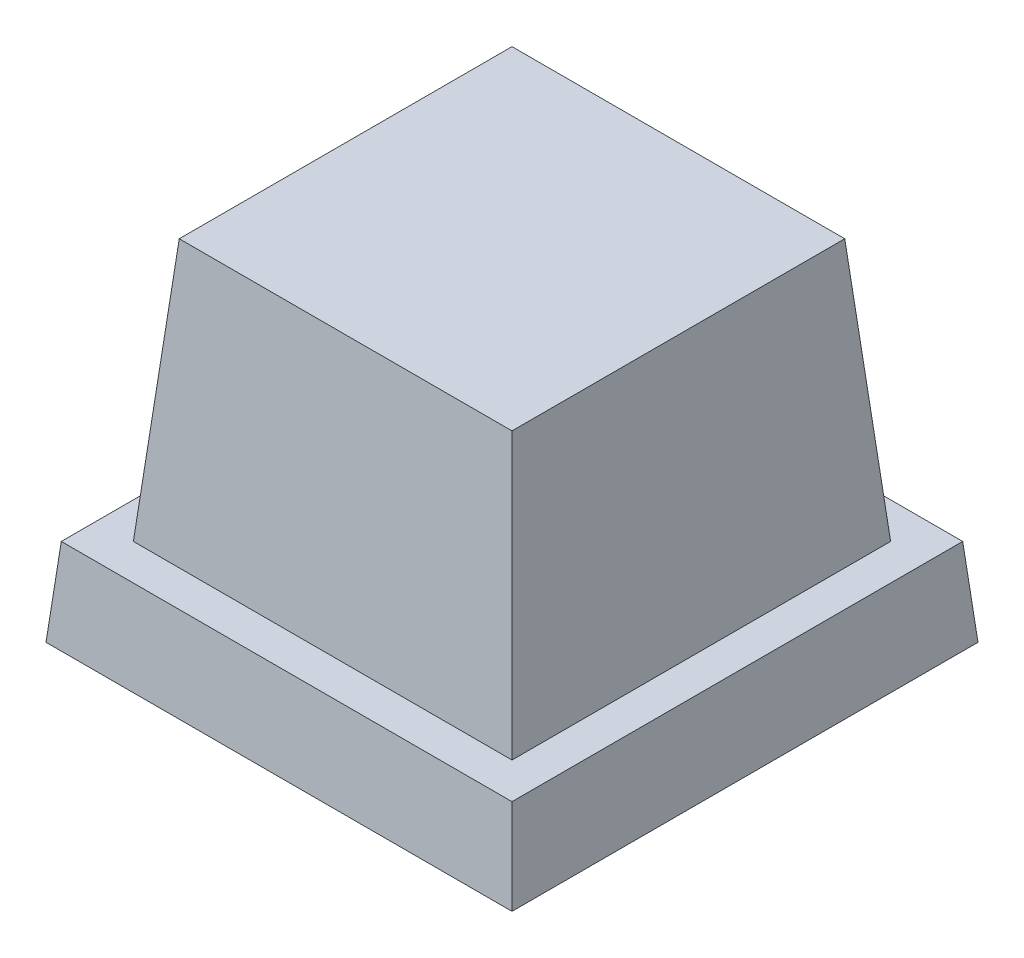
from build123d import *

# Parameters (mm, degrees)
SKETCH1_W           = 32
SKETCH1_H           = 32
BOSS_EXTRUDE1_DEPTH = 6
BOSS_EXTRUDE1_TAPER = 5
SKETCH2_W           = 26
SKETCH2_H           = 26
BOSS_EXTRUDE2_DEPTH = 18
BOSS_EXTRUDE2_TAPER = 5
SHELL1_T            = -0.8
CHAMFER1_SIZE       = 2.5
CHAMFER1_SIZE_2     = 2.750157169


with BuildPart() as part:
    # Sketch1 → Boss-Extrude1 (new body)
    with BuildSketch(Plane(origin=(0, 0, 0), x_dir=(1, 0, 0), z_dir=(0, 1, 0))):
        with Locations((-16, 16)):
            Rectangle(SKETCH1_W, SKETCH1_H)
    extrude(amount=BOSS_EXTRUDE1_DEPTH, taper=BOSS_EXTRUDE1_TAPER)

    # Sketch2 → Boss-Extrude2 (add)
    with BuildSketch(Plane(origin=(0, 6, 0), x_dir=(1, 0, 0), z_dir=(0, 1, 0))):
        with Locations((-16, 16)):
            Rectangle(SKETCH2_W, SKETCH2_H)
    extrude(amount=BOSS_EXTRUDE2_DEPTH, taper=BOSS_EXTRUDE2_TAPER)

    # Shell1
    shell1_openings = [part.faces().sort_by_distance(p)[0] for p in [
        (-16, 0, -16),
    ]]
    offset(amount=SHELL1_T, openings=shell1_openings, kind=Kind.INTERSECTION)

    # Chamfer1
    # the kernel refuses this chamfer: 2.750157169, 2.5 mm, written as the material it adds along each edge
    with BuildSketch(Plane(origin=(5.830274952, 5.2, -1.25799692), x_dir=(0, 0.030161850139926293, -0.9995450278982617), z_dir=(-1, 0, 0))) as chamfer1_piece_1_section:
        Polygon((CHAMFER1_SIZE * 0.999545027898, CHAMFER1_SIZE * 0.0301618501399), (-CHAMFER1_SIZE_2 * 0.117163164513, CHAMFER1_SIZE_2 * 0.993112678869), (0, 0), align=None)
    chamfer1_piece_1 = extrude(amount=43.660549905, mode=Mode.PRIVATE)
    chamfer1_piece_1 = split(chamfer1_piece_1, bisect_by=Plane(origin=(-1.2737044, 5.379537315, -3.779154262), z_dir=(-0.9961946980917455, -0.08715574274765792, 0)), keep=Keep.TOP, mode=Mode.PRIVATE)
    chamfer1_piece_1 = split(chamfer1_piece_1, bisect_by=Plane(origin=(-3.729971497, 5.164641789, -3.779154262), z_dir=(0.9961946980917455, 0.08715574274765821, 0)), keep=Keep.TOP, mode=Mode.PRIVATE)
    chamfer1_piece_1 = split(chamfer1_piece_1, bisect_by=Plane(origin=(-2.501837948, 5.275543614, -3.739674149), z_dir=(0, -0.08715574274765829, -0.9961946980917455)), keep=Keep.TOP, mode=Mode.PRIVATE)
    add(chamfer1_piece_1)
    with BuildSketch(Plane(origin=(5.830274952, 5.2, -1.25799692), x_dir=(0, 0.030161850139926293, -0.9995450278982617), z_dir=(-1, 0, 0))) as chamfer1_piece_2_section:
        Polygon((CHAMFER1_SIZE * 0.999545027898, CHAMFER1_SIZE * 0.0301618501399), (-CHAMFER1_SIZE_2 * 0.117163164513, CHAMFER1_SIZE_2 * 0.993112678869), (0, 0), align=None)
    chamfer1_piece_2 = extrude(amount=43.660549905, mode=Mode.PRIVATE)
    chamfer1_piece_2 = split(chamfer1_piece_2, bisect_by=Plane(origin=(-1.187972058, 4.399612159, -1.99521412), z_dir=(-0.9961946980917455, -0.08715574274765792, 0)), keep=Keep.TOP, mode=Mode.PRIVATE)
    chamfer1_piece_2 = split(chamfer1_piece_2, bisect_by=Plane(origin=(-3.644239154, 4.184716633, -1.99521412), z_dir=(0.9961946980917455, 0.08715574274765821, 0)), keep=Keep.TOP, mode=Mode.PRIVATE)
    chamfer1_piece_2 = split(chamfer1_piece_2, bisect_by=Plane(origin=(-2.416105606, 4.148173113, -3.641042011), z_dir=(0, 0.08715574274765829, 0.9961946980917455)), keep=Keep.TOP, mode=Mode.PRIVATE)
    add(chamfer1_piece_2)
    with BuildSketch(Plane(origin=(5.830274952, 5.2, -1.25799692), x_dir=(0, 0.030161850139926293, -0.9995450278982617), z_dir=(-1, 0, 0))) as chamfer1_piece_3_section:
        Polygon((CHAMFER1_SIZE * 0.999545027898, CHAMFER1_SIZE * 0.0301618501399), (-CHAMFER1_SIZE_2 * 0.117163164513, CHAMFER1_SIZE_2 * 0.993112678869), (0, 0), align=None)
    chamfer1_piece_3 = extrude(amount=43.660549905, mode=Mode.PRIVATE)
    chamfer1_piece_3 = split(chamfer1_piece_3, bisect_by=Plane(origin=(-3.747130429, 5.360769289, -1.993289961), z_dir=(-0.9961946980917455, -0.08715574274765821, 0)), keep=Keep.TOP, mode=Mode.PRIVATE)
    chamfer1_piece_3 = split(chamfer1_piece_3, bisect_by=Plane(origin=(-16, 4.144649452, -3.64073373), z_dir=(0, 0.08715574274765829, 0.9961946980917455)), keep=Keep.TOP, mode=Mode.PRIVATE)
    chamfer1_piece_3 = split(chamfer1_piece_3, bisect_by=Plane(origin=(-28.252869571, 5.360769289, -1.993289961), z_dir=(0.9961946980917455, -0.08715574274765829, 0)), keep=Keep.TOP, mode=Mode.PRIVATE)
    add(chamfer1_piece_3)
    with BuildSketch(Plane(origin=(5.830274952, 5.2, -1.25799692), x_dir=(0, 0.030161850139926293, -0.9995450278982617), z_dir=(-1, 0, 0))) as chamfer1_piece_4_section:
        Polygon((CHAMFER1_SIZE * 0.999545027898, CHAMFER1_SIZE * 0.0301618501399), (-CHAMFER1_SIZE_2 * 0.117163164513, CHAMFER1_SIZE_2 * 0.993112678869), (0, 0), align=None)
    chamfer1_piece_4 = extrude(amount=43.660549905, mode=Mode.PRIVATE)
    chamfer1_piece_4 = split(chamfer1_piece_4, bisect_by=Plane(origin=(-29.498162052, 5.275543614, -3.739674149), z_dir=(0, -0.08715574274765829, -0.9961946980917455)), keep=Keep.TOP, mode=Mode.PRIVATE)
    chamfer1_piece_4 = split(chamfer1_piece_4, bisect_by=Plane(origin=(-28.270028503, 5.164641789, -3.779154262), z_dir=(-0.9961946980917455, 0.08715574274765829, 0)), keep=Keep.TOP, mode=Mode.PRIVATE)
    chamfer1_piece_4 = split(chamfer1_piece_4, bisect_by=Plane(origin=(-30.7262956, 5.379537315, -3.779154262), z_dir=(0.9961946980917455, -0.08715574274765851, 0)), keep=Keep.TOP, mode=Mode.PRIVATE)
    add(chamfer1_piece_4)
    with BuildSketch(Plane(origin=(5.830274952, 5.2, -1.25799692), x_dir=(0, 0.030161850139926293, -0.9995450278982617), z_dir=(-1, 0, 0))) as chamfer1_piece_5_section:
        Polygon((CHAMFER1_SIZE * 0.999545027898, CHAMFER1_SIZE * 0.0301618501399), (-CHAMFER1_SIZE_2 * 0.117163164513, CHAMFER1_SIZE_2 * 0.993112678869), (0, 0), align=None)
    chamfer1_piece_5 = extrude(amount=43.660549905, mode=Mode.PRIVATE)
    chamfer1_piece_5 = split(chamfer1_piece_5, bisect_by=Plane(origin=(-29.583894394, 4.148173113, -3.641042011), z_dir=(0, 0.08715574274765829, 0.9961946980917455)), keep=Keep.TOP, mode=Mode.PRIVATE)
    chamfer1_piece_5 = split(chamfer1_piece_5, bisect_by=Plane(origin=(-28.355760846, 4.184716633, -1.99521412), z_dir=(-0.9961946980917455, 0.08715574274765829, 0)), keep=Keep.TOP, mode=Mode.PRIVATE)
    chamfer1_piece_5 = split(chamfer1_piece_5, bisect_by=Plane(origin=(-30.812027942, 4.399612159, -1.99521412), z_dir=(0.9961946980917455, -0.08715574274765851, 0)), keep=Keep.TOP, mode=Mode.PRIVATE)
    add(chamfer1_piece_5)
    with BuildSketch(Plane(origin=(-30.74200308, 5.2, 5.830274952), x_dir=(0.9995450278982617, 0.030161850139926356, 0), z_dir=(0, 0, -1))) as chamfer1_piece_6_section:
        Polygon((CHAMFER1_SIZE * 0.999545027898, CHAMFER1_SIZE * 0.0301618501399), (-CHAMFER1_SIZE_2 * 0.117163164513, CHAMFER1_SIZE_2 * 0.993112678869), (0, 0), align=None)
    chamfer1_piece_6 = extrude(amount=43.660549905, mode=Mode.PRIVATE)
    chamfer1_piece_6 = split(chamfer1_piece_6, bisect_by=Plane(origin=(-28.220845738, 5.164641789, -3.729971497), z_dir=(0, 0.08715574274765829, 0.9961946980917455)), keep=Keep.TOP, mode=Mode.PRIVATE)
    chamfer1_piece_6 = split(chamfer1_piece_6, bisect_by=Plane(origin=(-28.260325851, 5.275543614, -2.501837948), z_dir=(0.9961946980917455, -0.08715574274765829, 0)), keep=Keep.TOP, mode=Mode.PRIVATE)
    chamfer1_piece_6 = split(chamfer1_piece_6, bisect_by=Plane(origin=(-28.220845738, 5.379537315, -1.2737044), z_dir=(0, -0.08715574274765792, -0.9961946980917455)), keep=Keep.TOP, mode=Mode.PRIVATE)
    add(chamfer1_piece_6)
    with BuildSketch(Plane(origin=(-30.74200308, 5.2, 5.830274952), x_dir=(0.9995450278982617, 0.030161850139926356, 0), z_dir=(0, 0, -1))) as chamfer1_piece_7_section:
        Polygon((CHAMFER1_SIZE * 0.999545027898, CHAMFER1_SIZE * 0.0301618501399), (-CHAMFER1_SIZE_2 * 0.117163164513, CHAMFER1_SIZE_2 * 0.993112678869), (0, 0), align=None)
    chamfer1_piece_7 = extrude(amount=43.660549905, mode=Mode.PRIVATE)
    chamfer1_piece_7 = split(chamfer1_piece_7, bisect_by=Plane(origin=(-30.00478588, 4.184716633, -3.644239154), z_dir=(0, 0.08715574274765829, 0.9961946980917455)), keep=Keep.TOP, mode=Mode.PRIVATE)
    chamfer1_piece_7 = split(chamfer1_piece_7, bisect_by=Plane(origin=(-28.358957989, 4.148173113, -2.416105606), z_dir=(-0.9961946980917455, 0.08715574274765829, 0)), keep=Keep.TOP, mode=Mode.PRIVATE)
    chamfer1_piece_7 = split(chamfer1_piece_7, bisect_by=Plane(origin=(-30.00478588, 4.399612159, -1.187972058), z_dir=(0, -0.08715574274765792, -0.9961946980917455)), keep=Keep.TOP, mode=Mode.PRIVATE)
    add(chamfer1_piece_7)
    with BuildSketch(Plane(origin=(-30.74200308, 5.2, 5.830274952), x_dir=(0.9995450278982617, 0.030161850139926356, 0), z_dir=(0, 0, -1))) as chamfer1_piece_8_section:
        Polygon((CHAMFER1_SIZE * 0.999545027898, CHAMFER1_SIZE * 0.0301618501399), (-CHAMFER1_SIZE_2 * 0.117163164513, CHAMFER1_SIZE_2 * 0.993112678869), (0, 0), align=None)
    chamfer1_piece_8 = extrude(amount=43.660549905, mode=Mode.PRIVATE)
    chamfer1_piece_8 = split(chamfer1_piece_8, bisect_by=Plane(origin=(-30.006710039, 5.360769289, -28.252869571), z_dir=(0, -0.08715574274765829, 0.9961946980917455)), keep=Keep.TOP, mode=Mode.PRIVATE)
    chamfer1_piece_8 = split(chamfer1_piece_8, bisect_by=Plane(origin=(-30.006710039, 5.360769289, -3.747130429), z_dir=(0, -0.08715574274765829, -0.9961946980917455)), keep=Keep.TOP, mode=Mode.PRIVATE)
    chamfer1_piece_8 = split(chamfer1_piece_8, bisect_by=Plane(origin=(-28.35926627, 4.144649452, -16), z_dir=(-0.9961946980917455, 0.08715574274765829, 0)), keep=Keep.TOP, mode=Mode.PRIVATE)
    add(chamfer1_piece_8)
    with BuildSketch(Plane(origin=(-30.74200308, 5.2, 5.830274952), x_dir=(0.9995450278982617, 0.030161850139926356, 0), z_dir=(0, 0, -1))) as chamfer1_piece_9_section:
        Polygon((CHAMFER1_SIZE * 0.999545027898, CHAMFER1_SIZE * 0.0301618501399), (-CHAMFER1_SIZE_2 * 0.117163164513, CHAMFER1_SIZE_2 * 0.993112678869), (0, 0), align=None)
    chamfer1_piece_9 = extrude(amount=43.660549905, mode=Mode.PRIVATE)
    chamfer1_piece_9 = split(chamfer1_piece_9, bisect_by=Plane(origin=(-28.220845738, 5.379537315, -30.7262956), z_dir=(0, -0.08715574274765836, 0.9961946980917455)), keep=Keep.TOP, mode=Mode.PRIVATE)
    chamfer1_piece_9 = split(chamfer1_piece_9, bisect_by=Plane(origin=(-28.220845738, 5.164641789, -28.270028503), z_dir=(0, 0.08715574274765829, -0.9961946980917455)), keep=Keep.TOP, mode=Mode.PRIVATE)
    chamfer1_piece_9 = split(chamfer1_piece_9, bisect_by=Plane(origin=(-28.260325851, 5.275543614, -29.498162052), z_dir=(0.9961946980917455, -0.08715574274765829, 0)), keep=Keep.TOP, mode=Mode.PRIVATE)
    add(chamfer1_piece_9)
    with BuildSketch(Plane(origin=(-30.74200308, 5.2, 5.830274952), x_dir=(0.9995450278982617, 0.030161850139926356, 0), z_dir=(0, 0, -1))) as chamfer1_piece_10_section:
        Polygon((CHAMFER1_SIZE * 0.999545027898, CHAMFER1_SIZE * 0.0301618501399), (-CHAMFER1_SIZE_2 * 0.117163164513, CHAMFER1_SIZE_2 * 0.993112678869), (0, 0), align=None)
    chamfer1_piece_10 = extrude(amount=43.660549905, mode=Mode.PRIVATE)
    chamfer1_piece_10 = split(chamfer1_piece_10, bisect_by=Plane(origin=(-30.00478588, 4.399612159, -30.812027942), z_dir=(0, -0.08715574274765836, 0.9961946980917455)), keep=Keep.TOP, mode=Mode.PRIVATE)
    chamfer1_piece_10 = split(chamfer1_piece_10, bisect_by=Plane(origin=(-30.00478588, 4.184716633, -28.355760846), z_dir=(0, 0.08715574274765829, -0.9961946980917455)), keep=Keep.TOP, mode=Mode.PRIVATE)
    chamfer1_piece_10 = split(chamfer1_piece_10, bisect_by=Plane(origin=(-28.358957989, 4.148173113, -29.583894394), z_dir=(-0.9961946980917455, 0.08715574274765829, 0)), keep=Keep.TOP, mode=Mode.PRIVATE)
    add(chamfer1_piece_10)
    with BuildSketch(Plane(origin=(5.830274952, 5.2, -30.74200308), x_dir=(0, -0.9937112432628153, -0.11197305485280758), z_dir=(-1, 0, 0))) as chamfer1_piece_11_section:
        Polygon((CHAMFER1_SIZE_2 * 0.99968896676, CHAMFER1_SIZE_2 * 0.0249393220908), (-CHAMFER1_SIZE * 0.111973054853, CHAMFER1_SIZE * 0.993711243263), (0, 0), align=None)
    chamfer1_piece_11 = extrude(amount=43.660549905, mode=Mode.PRIVATE)
    chamfer1_piece_11 = split(chamfer1_piece_11, bisect_by=Plane(origin=(-1.187972058, 4.399612159, -30.00478588), z_dir=(-0.9961946980917455, -0.08715574274765792, 0)), keep=Keep.TOP, mode=Mode.PRIVATE)
    chamfer1_piece_11 = split(chamfer1_piece_11, bisect_by=Plane(origin=(-2.416105606, 4.148173113, -28.358957989), z_dir=(0, 0.08715574274765829, -0.9961946980917455)), keep=Keep.TOP, mode=Mode.PRIVATE)
    chamfer1_piece_11 = split(chamfer1_piece_11, bisect_by=Plane(origin=(-3.644239154, 4.184716633, -30.00478588), z_dir=(0.9961946980917455, 0.08715574274765821, 0)), keep=Keep.TOP, mode=Mode.PRIVATE)
    add(chamfer1_piece_11)
    with BuildSketch(Plane(origin=(5.830274952, 5.2, -30.74200308), x_dir=(0, -0.9937112432628153, -0.11197305485280758), z_dir=(-1, 0, 0))) as chamfer1_piece_12_section:
        Polygon((CHAMFER1_SIZE_2 * 0.99968896676, CHAMFER1_SIZE_2 * 0.0249393220908), (-CHAMFER1_SIZE * 0.111973054853, CHAMFER1_SIZE * 0.993711243263), (0, 0), align=None)
    chamfer1_piece_12 = extrude(amount=43.660549905, mode=Mode.PRIVATE)
    chamfer1_piece_12 = split(chamfer1_piece_12, bisect_by=Plane(origin=(-1.2737044, 5.379537315, -28.220845738), z_dir=(-0.9961946980917455, -0.08715574274765792, 0)), keep=Keep.TOP, mode=Mode.PRIVATE)
    chamfer1_piece_12 = split(chamfer1_piece_12, bisect_by=Plane(origin=(-2.501837948, 5.275543614, -28.260325851), z_dir=(0, -0.08715574274765829, 0.9961946980917455)), keep=Keep.TOP, mode=Mode.PRIVATE)
    chamfer1_piece_12 = split(chamfer1_piece_12, bisect_by=Plane(origin=(-3.729971497, 5.164641789, -28.220845738), z_dir=(0.9961946980917455, 0.08715574274765821, 0)), keep=Keep.TOP, mode=Mode.PRIVATE)
    add(chamfer1_piece_12)
    with BuildSketch(Plane(origin=(5.830274952, 5.2, -30.74200308), x_dir=(0, -0.9937112432628153, -0.11197305485280758), z_dir=(-1, 0, 0))) as chamfer1_piece_13_section:
        Polygon((CHAMFER1_SIZE_2 * 0.99968896676, CHAMFER1_SIZE_2 * 0.0249393220908), (-CHAMFER1_SIZE * 0.111973054853, CHAMFER1_SIZE * 0.993711243263), (0, 0), align=None)
    chamfer1_piece_13 = extrude(amount=43.660549905, mode=Mode.PRIVATE)
    chamfer1_piece_13 = split(chamfer1_piece_13, bisect_by=Plane(origin=(-16, 4.144649452, -28.35926627), z_dir=(0, 0.08715574274765829, -0.9961946980917455)), keep=Keep.TOP, mode=Mode.PRIVATE)
    chamfer1_piece_13 = split(chamfer1_piece_13, bisect_by=Plane(origin=(-3.747130429, 5.360769289, -30.006710039), z_dir=(-0.9961946980917455, -0.08715574274765821, 0)), keep=Keep.TOP, mode=Mode.PRIVATE)
    chamfer1_piece_13 = split(chamfer1_piece_13, bisect_by=Plane(origin=(-28.252869571, 5.360769289, -30.006710039), z_dir=(0.9961946980917455, -0.08715574274765829, 0)), keep=Keep.TOP, mode=Mode.PRIVATE)
    add(chamfer1_piece_13)
    with BuildSketch(Plane(origin=(5.830274952, 5.2, -30.74200308), x_dir=(0, -0.9937112432628153, -0.11197305485280758), z_dir=(-1, 0, 0))) as chamfer1_piece_14_section:
        Polygon((CHAMFER1_SIZE_2 * 0.99968896676, CHAMFER1_SIZE_2 * 0.0249393220908), (-CHAMFER1_SIZE * 0.111973054853, CHAMFER1_SIZE * 0.993711243263), (0, 0), align=None)
    chamfer1_piece_14 = extrude(amount=43.660549905, mode=Mode.PRIVATE)
    chamfer1_piece_14 = split(chamfer1_piece_14, bisect_by=Plane(origin=(-30.812027942, 4.399612159, -30.00478588), z_dir=(0.9961946980917455, -0.08715574274765851, 0)), keep=Keep.TOP, mode=Mode.PRIVATE)
    chamfer1_piece_14 = split(chamfer1_piece_14, bisect_by=Plane(origin=(-29.583894394, 4.148173113, -28.358957989), z_dir=(0, 0.08715574274765829, -0.9961946980917455)), keep=Keep.TOP, mode=Mode.PRIVATE)
    chamfer1_piece_14 = split(chamfer1_piece_14, bisect_by=Plane(origin=(-28.355760846, 4.184716633, -30.00478588), z_dir=(-0.9961946980917455, 0.08715574274765829, 0)), keep=Keep.TOP, mode=Mode.PRIVATE)
    add(chamfer1_piece_14)
    with BuildSketch(Plane(origin=(5.830274952, 5.2, -30.74200308), x_dir=(0, -0.9937112432628153, -0.11197305485280758), z_dir=(-1, 0, 0))) as chamfer1_piece_15_section:
        Polygon((CHAMFER1_SIZE_2 * 0.99968896676, CHAMFER1_SIZE_2 * 0.0249393220908), (-CHAMFER1_SIZE * 0.111973054853, CHAMFER1_SIZE * 0.993711243263), (0, 0), align=None)
    chamfer1_piece_15 = extrude(amount=43.660549905, mode=Mode.PRIVATE)
    chamfer1_piece_15 = split(chamfer1_piece_15, bisect_by=Plane(origin=(-30.7262956, 5.379537315, -28.220845738), z_dir=(0.9961946980917455, -0.08715574274765851, 0)), keep=Keep.TOP, mode=Mode.PRIVATE)
    chamfer1_piece_15 = split(chamfer1_piece_15, bisect_by=Plane(origin=(-29.498162052, 5.275543614, -28.260325851), z_dir=(0, -0.08715574274765829, 0.9961946980917455)), keep=Keep.TOP, mode=Mode.PRIVATE)
    chamfer1_piece_15 = split(chamfer1_piece_15, bisect_by=Plane(origin=(-28.270028503, 5.164641789, -28.220845738), z_dir=(-0.9961946980917455, 0.08715574274765829, 0)), keep=Keep.TOP, mode=Mode.PRIVATE)
    add(chamfer1_piece_15)
    with BuildSketch(Plane(origin=(-1.25799692, 5.2, 5.830274952), x_dir=(0.11197305485280797, -0.9937112432628151, 0), z_dir=(0, 0, -1))) as chamfer1_piece_16_section:
        Polygon((CHAMFER1_SIZE_2 * 0.99968896676, CHAMFER1_SIZE_2 * 0.0249393220908), (-CHAMFER1_SIZE * 0.111973054853, CHAMFER1_SIZE * 0.993711243263), (0, 0), align=None)
    chamfer1_piece_16 = extrude(amount=43.660549905, mode=Mode.PRIVATE)
    chamfer1_piece_16 = split(chamfer1_piece_16, bisect_by=Plane(origin=(-1.99521412, 4.399612159, -1.187972058), z_dir=(0, -0.08715574274765792, -0.9961946980917455)), keep=Keep.TOP, mode=Mode.PRIVATE)
    chamfer1_piece_16 = split(chamfer1_piece_16, bisect_by=Plane(origin=(-3.641042011, 4.148173113, -2.416105606), z_dir=(0.9961946980917455, 0.08715574274765821, 0)), keep=Keep.TOP, mode=Mode.PRIVATE)
    chamfer1_piece_16 = split(chamfer1_piece_16, bisect_by=Plane(origin=(-1.99521412, 4.184716633, -3.644239154), z_dir=(0, 0.08715574274765829, 0.9961946980917455)), keep=Keep.TOP, mode=Mode.PRIVATE)
    add(chamfer1_piece_16)
    with BuildSketch(Plane(origin=(-1.25799692, 5.2, 5.830274952), x_dir=(0.11197305485280797, -0.9937112432628151, 0), z_dir=(0, 0, -1))) as chamfer1_piece_17_section:
        Polygon((CHAMFER1_SIZE_2 * 0.99968896676, CHAMFER1_SIZE_2 * 0.0249393220908), (-CHAMFER1_SIZE * 0.111973054853, CHAMFER1_SIZE * 0.993711243263), (0, 0), align=None)
    chamfer1_piece_17 = extrude(amount=43.660549905, mode=Mode.PRIVATE)
    chamfer1_piece_17 = split(chamfer1_piece_17, bisect_by=Plane(origin=(-3.779154262, 5.379537315, -1.2737044), z_dir=(0, -0.08715574274765792, -0.9961946980917455)), keep=Keep.TOP, mode=Mode.PRIVATE)
    chamfer1_piece_17 = split(chamfer1_piece_17, bisect_by=Plane(origin=(-3.739674149, 5.275543614, -2.501837948), z_dir=(-0.9961946980917455, -0.08715574274765821, 0)), keep=Keep.TOP, mode=Mode.PRIVATE)
    chamfer1_piece_17 = split(chamfer1_piece_17, bisect_by=Plane(origin=(-3.779154262, 5.164641789, -3.729971497), z_dir=(0, 0.08715574274765829, 0.9961946980917455)), keep=Keep.TOP, mode=Mode.PRIVATE)
    add(chamfer1_piece_17)
    with BuildSketch(Plane(origin=(-1.25799692, 5.2, 5.830274952), x_dir=(0.11197305485280797, -0.9937112432628151, 0), z_dir=(0, 0, -1))) as chamfer1_piece_18_section:
        Polygon((CHAMFER1_SIZE_2 * 0.99968896676, CHAMFER1_SIZE_2 * 0.0249393220908), (-CHAMFER1_SIZE * 0.111973054853, CHAMFER1_SIZE * 0.993711243263), (0, 0), align=None)
    chamfer1_piece_18 = extrude(amount=43.660549905, mode=Mode.PRIVATE)
    chamfer1_piece_18 = split(chamfer1_piece_18, bisect_by=Plane(origin=(-1.993289961, 5.360769289, -28.252869571), z_dir=(0, -0.08715574274765829, 0.9961946980917455)), keep=Keep.TOP, mode=Mode.PRIVATE)
    chamfer1_piece_18 = split(chamfer1_piece_18, bisect_by=Plane(origin=(-3.64073373, 4.144649452, -16), z_dir=(0.9961946980917455, 0.08715574274765821, 0)), keep=Keep.TOP, mode=Mode.PRIVATE)
    chamfer1_piece_18 = split(chamfer1_piece_18, bisect_by=Plane(origin=(-1.993289961, 5.360769289, -3.747130429), z_dir=(0, -0.08715574274765829, -0.9961946980917455)), keep=Keep.TOP, mode=Mode.PRIVATE)
    add(chamfer1_piece_18)
    with BuildSketch(Plane(origin=(-1.25799692, 5.2, 5.830274952), x_dir=(0.11197305485280797, -0.9937112432628151, 0), z_dir=(0, 0, -1))) as chamfer1_piece_19_section:
        Polygon((CHAMFER1_SIZE_2 * 0.99968896676, CHAMFER1_SIZE_2 * 0.0249393220908), (-CHAMFER1_SIZE * 0.111973054853, CHAMFER1_SIZE * 0.993711243263), (0, 0), align=None)
    chamfer1_piece_19 = extrude(amount=43.660549905, mode=Mode.PRIVATE)
    chamfer1_piece_19 = split(chamfer1_piece_19, bisect_by=Plane(origin=(-1.99521412, 4.399612159, -30.812027942), z_dir=(0, -0.08715574274765836, 0.9961946980917455)), keep=Keep.TOP, mode=Mode.PRIVATE)
    chamfer1_piece_19 = split(chamfer1_piece_19, bisect_by=Plane(origin=(-1.99521412, 4.184716633, -28.355760846), z_dir=(0, 0.08715574274765829, -0.9961946980917455)), keep=Keep.TOP, mode=Mode.PRIVATE)
    chamfer1_piece_19 = split(chamfer1_piece_19, bisect_by=Plane(origin=(-3.641042011, 4.148173113, -29.583894394), z_dir=(0.9961946980917455, 0.08715574274765821, 0)), keep=Keep.TOP, mode=Mode.PRIVATE)
    add(chamfer1_piece_19)
    with BuildSketch(Plane(origin=(-1.25799692, 5.2, 5.830274952), x_dir=(0.11197305485280797, -0.9937112432628151, 0), z_dir=(0, 0, -1))) as chamfer1_piece_20_section:
        Polygon((CHAMFER1_SIZE_2 * 0.99968896676, CHAMFER1_SIZE_2 * 0.0249393220908), (-CHAMFER1_SIZE * 0.111973054853, CHAMFER1_SIZE * 0.993711243263), (0, 0), align=None)
    chamfer1_piece_20 = extrude(amount=43.660549905, mode=Mode.PRIVATE)
    chamfer1_piece_20 = split(chamfer1_piece_20, bisect_by=Plane(origin=(-3.779154262, 5.379537315, -30.7262956), z_dir=(0, -0.08715574274765836, 0.9961946980917455)), keep=Keep.TOP, mode=Mode.PRIVATE)
    chamfer1_piece_20 = split(chamfer1_piece_20, bisect_by=Plane(origin=(-3.779154262, 5.164641789, -28.270028503), z_dir=(0, 0.08715574274765829, -0.9961946980917455)), keep=Keep.TOP, mode=Mode.PRIVATE)
    chamfer1_piece_20 = split(chamfer1_piece_20, bisect_by=Plane(origin=(-3.739674149, 5.275543614, -29.498162052), z_dir=(-0.9961946980917455, -0.08715574274765821, 0)), keep=Keep.TOP, mode=Mode.PRIVATE)
    add(chamfer1_piece_20)


solid = part.part
